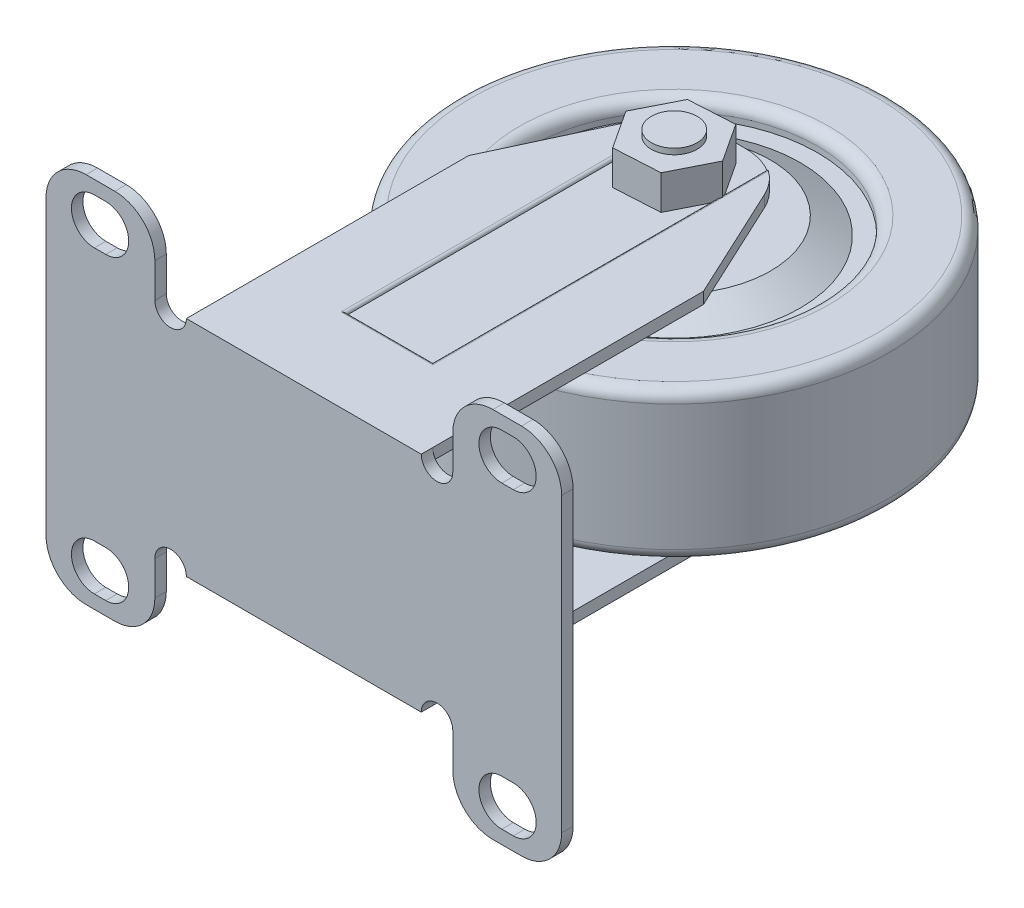
from build123d import *

# Parameters (mm, degrees)
SKETCH_1_W               = 90
SKETCH_1_H               = 65
EXTRUDE_1_DEPTH          = 2
SKETCH_2_W               = 52
SKETCH_2_H               = 13
CUT_EXTRUDE_1_DEPTH      = 56.54502678
CUT_EXTRUDE_2_DEPTH      = 56.54502678
MIRROR_3_COPY_1_DEPTH    = 56.54502678
FILLET_1_R               = 7
SKETCH_4_W               = 41
SKETCH_4_H               = 2
EXTRUDE_2_DEPTH          = 73
SKETCH_5_W               = 15
SKETCH_5_H               = 59.991373208
CUT_EXTRUDE_3_DEPTH      = 0.5
FILLET_2_R               = 0.5
FILLET_3_R               = 0.5
CHAMFER_4_SIZE           = 12
CHAMFER_4_SIZE2          = 25.734083046
CHAMFER_5_SIZE           = 12
CHAMFER_5_SIZE2          = 25.734083046
CHAMFER_6_SIZE           = 12
CHAMFER_6_SIZE2          = 25.734083046
CHAMFER_7_SIZE           = 12
CHAMFER_7_SIZE2          = 25.734083046
FILLET_4_R               = 10
EXTRUDE_3_DEPTH          = 6
EXTRUDE_START            = -41
SKETCH_7_R               = 4
EXTRUDE_4_DEPTH          = 42
SKETCH_8_R               = 2.75
CUT_EXTRUDE_4_DEPTH      = 92.707415265
MIRROR_9_COPY_1_SKETCH_R = 2.75
MIRROR_9_COPY_1_DEPTH    = 92.707415265
EXTRUDE_7_DEPTH          = 13
EXTRUDE_7_DEPTH_BACK     = 13
SKETCH_10_R              = 37.5
FILLET_5_R               = 2
SKETCH_11_R              = 25
SKETCH_11_R_2            = 22
CUT_EXTRUDE_5_DEPTH      = 3
FILLET_6_R               = 2
FILLET_7_R               = 2
CHAMFER_8_SIZE2          = 5.196152423
CHAMFER_8_SIZE           = 3
CHAMFER_9_SIZE2          = 3
CHAMFER_9_SIZE           = 5.196152423


with BuildPart() as part:
    # 草图1 → 凸台-拉伸1 (new body)
    with BuildSketch(Plane.XY):
        Rectangle(SKETCH_1_W, SKETCH_1_H)
    extrude(amount=EXTRUDE_1_DEPTH)

    # 草图2 → 切除-拉伸1 (cut, through all)
    with BuildSketch(Plane.XY.offset(2)):
        with Locations((0, 26)):
            Rectangle(SKETCH_2_W, SKETCH_2_H)
    cut_extrude_1 = extrude(amount=-CUT_EXTRUDE_1_DEPTH, mode=Mode.SUBTRACT)

    # 镜向1: 切除-拉伸1 across plane
    add(cut_extrude_1.mirror(Plane.ZX), mode=Mode.SUBTRACT)

    # 草图3 → 切除-拉伸2 (cut, through all)
    with BuildSketch(Plane.XY.offset(2)):
        with BuildLine():
            Line((-36.562223186, 30.159744382), (-34.562223186, 30.159744382))
            ThreePointArc((-34.562223186, 30.159744382), (-30.562223186, 26.159744382), (-34.562223186, 22.159744382))
            Line((-34.562223186, 22.159744382), (-36.562223186, 22.159744382))
            ThreePointArc((-36.562223186, 22.159744382), (-40.562223186, 26.159744382), (-36.562223186, 30.159744382))
        make_face()
    cut_extrude_2 = extrude(amount=-CUT_EXTRUDE_2_DEPTH, mode=Mode.SUBTRACT)

    # 镜向2: 切除-拉伸2 across plane
    add(cut_extrude_2.mirror(Plane(origin=(0, 0, 0), x_dir=(0, 0, 1), z_dir=(1, 0, 0))), mode=Mode.SUBTRACT)

    # 镜向3: 切除-拉伸2 across plane
    add(cut_extrude_2.mirror(Plane.ZX), mode=Mode.SUBTRACT)

    # 镜向3 copy 1 sketch → 镜向3 copy 1 (cut, through all)
    with BuildSketch(Plane(origin=(0, 0, 2), x_dir=(-1, 0, 0), z_dir=(0, 0, 1))):
        with BuildLine():
            Line((-36.562223186, 30.159744382), (-34.562223186, 30.159744382))
            ThreePointArc((-34.562223186, 30.159744382), (-30.562223186, 26.159744382), (-34.562223186, 22.159744382))
            Line((-34.562223186, 22.159744382), (-36.562223186, 22.159744382))
            ThreePointArc((-36.562223186, 22.159744382), (-40.562223186, 26.159744382), (-36.562223186, 30.159744382))
        make_face()
    extrude(amount=-MIRROR_3_COPY_1_DEPTH, mode=Mode.SUBTRACT)

    # 圆角1
    fillet_1_edges = [part.edges().sort_by_distance(p)[0] for p in [
        (-26, 32.5, 1),
        (26, 32.5, 1),
        (-26, -32.5, 1),
        (26, -32.5, 1),
        (45, -32.5, 1),
        (-45, -32.5, 1),
        (-45, 32.5, 1),
        (45, 32.5, 1),
    ]]
    fillet(fillet_1_edges, radius=FILLET_1_R)

    # 草图4 → 凸台-拉伸2 (add)
    with BuildSketch(Plane(origin=(0, 0, 0), x_dir=(-1, 0, 0), z_dir=(0, 0, -1))):
        with Locations((0, 18.5)):
            Rectangle(SKETCH_4_W, SKETCH_4_H)
    extrude_2 = extrude(amount=EXTRUDE_2_DEPTH)

    # 镜向4: 凸台-拉伸2 across plane
    add(extrude_2.mirror(Plane.ZX))

    # 草图5 → 切除-拉伸3 (cut)
    with BuildSketch(Plane(origin=(0, 19.5, 0), x_dir=(1, 0, 0), z_dir=(0, 1, 0))):
        with Locations((0, 43.004313396)):
            Rectangle(SKETCH_5_W, SKETCH_5_H)
    cut_extrude_3 = extrude(amount=-CUT_EXTRUDE_3_DEPTH, mode=Mode.SUBTRACT)

    # 圆角2
    fillet_2_edges = [part.edges().sort_by_distance(p)[0] for p in [
        (0, 19.5, -13.008626792),
        (7.5, 19.5, -43.004313396),
        (-7.5, 19.5, -43.004313396),
    ]]
    fillet(fillet_2_edges, radius=FILLET_2_R - 0.0001)  # a hair under: the kernel refuses the full size

    # 镜向6: 切除-拉伸3 across plane
    add(cut_extrude_3.mirror(Plane.ZX), mode=Mode.SUBTRACT)

    # 圆角3
    fillet_3_edges = [part.edges().sort_by_distance(p)[0] for p in [
        (7.5, -19.5, -43.004313396),
        (-7.5, -19.5, -43.004313396),
        (0, -19.5, -13.008626792),
    ]]
    fillet(fillet_3_edges, radius=FILLET_3_R - 0.0001)  # a hair under: the kernel refuses the full size

    # 倒角4
    chamfer_4_edges = [part.edges().sort_by_distance(p)[0] for p in [
        (-20.5, -18.5, -73),
    ]]
    chamfer_4_side = [part.faces().sort_by_distance(p)[0] for p in [
        (0, -18.423106996, -73),
    ]]
    chamfer(chamfer_4_edges, length=CHAMFER_4_SIZE, length2=CHAMFER_4_SIZE2, reference=chamfer_4_side[0])

    # 倒角5
    chamfer_5_edges = [part.edges().sort_by_distance(p)[0] for p in [
        (20.5, -18.5, -73),
    ]]
    chamfer_5_side = [part.faces().sort_by_distance(p)[0] for p in [
        (6.905756389, -18.386486006, -73),
    ]]
    chamfer(chamfer_5_edges, length=CHAMFER_5_SIZE, length2=CHAMFER_5_SIZE2, reference=chamfer_5_side[0])

    # 倒角6
    chamfer_6_edges = [part.edges().sort_by_distance(p)[0] for p in [
        (20.5, 18.5, -73),
    ]]
    chamfer_6_side = [part.faces().sort_by_distance(p)[0] for p in [
        (0, 18.423106996, -73),
    ]]
    chamfer(chamfer_6_edges, length=CHAMFER_6_SIZE, length2=CHAMFER_6_SIZE2, reference=chamfer_6_side[0])

    # 倒角7
    chamfer_7_edges = [part.edges().sort_by_distance(p)[0] for p in [
        (-20.5, 18.5, -73),
    ]]
    chamfer_7_side = [part.faces().sort_by_distance(p)[0] for p in [
        (-6.905756389, 18.386486006, -73),
    ]]
    chamfer(chamfer_7_edges, length=CHAMFER_7_SIZE, length2=CHAMFER_7_SIZE2, reference=chamfer_7_side[0])

    # 圆角4
    fillet_4_edges = [part.edges().sort_by_distance(p)[0] for p in [
        (-8.5, 18.5, -73),
        (8.5, 18.5, -73),
        (8.5, -18.5, -73),
        (-8.5, -18.5, -73),
    ]]
    fillet(fillet_4_edges, radius=FILLET_4_R)

    # 草图6 → 凸台-拉伸3 (add)
    with BuildSketch(Plane(origin=(0, 19, 0), x_dir=(1, 0, 0), z_dir=(0, 1, 0))):
        Polygon((-4.39108988, 69.342635878), (-7.986809677, 62.196252237), (-3.595719796, 55.509075728), (4.39108988, 55.96828286), (7.986809677, 63.114666501), (3.595719796, 69.801843011), align=None)
    extrude_3 = extrude(amount=EXTRUDE_3_DEPTH)

    # 草图7 → 凸台-拉伸4 (add)
    with BuildSketch(Plane(origin=(0, 25, 0), x_dir=(1, 0, 0), z_dir=(0, 1, 0)).offset(EXTRUDE_START)):
        with Locations(Location((0, 62.655459369, 0), (0, 0, 270))):
            Circle(SKETCH_7_R)
    extrude_4 = extrude(amount=EXTRUDE_4_DEPTH)

    # 镜向7: 凸台-拉伸3, 凸台-拉伸4 across plane
    add(extrude_3.mirror(Plane.ZX))
    add(extrude_4.mirror(Plane.ZX))

    # 草图8 → 切除-拉伸4 (cut, through all)
    with BuildSketch(Plane(origin=(0, 0, 0), x_dir=(-1, 0, 0), z_dir=(0, 0, -1))):
        with Locations((-23.25, 19.5)):
            Circle(SKETCH_8_R)
    cut_extrude_4 = extrude(amount=-CUT_EXTRUDE_4_DEPTH, mode=Mode.SUBTRACT)

    # 镜向8: 切除-拉伸4 across plane
    add(cut_extrude_4.mirror(Plane.ZX), mode=Mode.SUBTRACT)

    # 镜向9: 切除-拉伸4 across plane
    add(cut_extrude_4.mirror(Plane(origin=(0, 0, 0), x_dir=(0, 0, 1), z_dir=(1, 0, 0))), mode=Mode.SUBTRACT)

    # 镜向9 copy 1 sketch → 镜向9 copy 1 (cut, through all)
    with BuildSketch(Plane(origin=(0, 0, 0), x_dir=(1, 0, 0), z_dir=(0, 0, -1))):
        with Locations((-23.25, 19.5)):
            Circle(MIRROR_9_COPY_1_SKETCH_R)
    extrude(amount=-MIRROR_9_COPY_1_DEPTH, mode=Mode.SUBTRACT)

    # 草图10 → 凸台-拉伸7 (add, two sides: drawn at the far end of the back side and taken through both)
    with BuildSketch(Plane(origin=(0, 0, 0), x_dir=(1, 0, 0), z_dir=(0, 1, 0)).offset(-EXTRUDE_7_DEPTH_BACK)):
        with Locations(Location((0, 62.655459369, 0), (0, 0, 270))):
            Circle(SKETCH_10_R)
    extrude(amount=EXTRUDE_7_DEPTH + EXTRUDE_7_DEPTH_BACK)

    # 圆角5
    fillet_5_edges = [part.edges().sort_by_distance(p)[0] for p in [
        (0, -13, -100.155459369),
        (0, 13, -100.155459369),
    ]]
    fillet(fillet_5_edges, radius=FILLET_5_R)

    # 草图11 → 切除-拉伸5 (cut)
    with BuildSketch(Plane(origin=(0, 13, 0), x_dir=(1, 0, 0), z_dir=(0, 1, 0))):
        with Locations(Location((0, 62.655459369, 0), (0, 0, 270))):
            Circle(SKETCH_11_R)
        with Locations(Location((0, 62.655459369, 0), (0, 0, 270))):
            Circle(SKETCH_11_R_2, mode=Mode.SUBTRACT)
    cut_extrude_5 = extrude(amount=-CUT_EXTRUDE_5_DEPTH, mode=Mode.SUBTRACT)

    # 圆角6
    fillet_6_edges = [part.edges().sort_by_distance(p)[0] for p in [
        (0, 13, -87.655459369),
    ]]
    fillet(fillet_6_edges, radius=FILLET_6_R)

    # 镜向10: 切除-拉伸5 across plane
    add(cut_extrude_5.mirror(Plane.ZX), mode=Mode.SUBTRACT)

    # 圆角7
    fillet_7_edges = [part.edges().sort_by_distance(p)[0] for p in [
        (0, -13, -87.655459369),
    ]]
    fillet(fillet_7_edges, radius=FILLET_7_R)

    # 倒角8
    chamfer_8_edges = [part.edges().sort_by_distance(p)[0] for p in [
        (0, 13, -84.655459369),
    ]]
    chamfer_8_side = [part.faces().sort_by_distance(p)[0] for p in [
        (0, 12.94, -84.655459369),
    ]]
    chamfer(chamfer_8_edges, length=CHAMFER_8_SIZE - 0.0001, length2=CHAMFER_8_SIZE2 - 0.0001, reference=chamfer_8_side[0])  # a hair under: the kernel refuses the full size

    # 倒角9
    chamfer_9_edges = [part.edges().sort_by_distance(p)[0] for p in [
        (0, -13, -84.655459369),
    ]]
    chamfer_9_side = [part.faces().sort_by_distance(p)[0] for p in [
        (0, -13, -84.595459369),
    ]]
    chamfer(chamfer_9_edges, length=CHAMFER_9_SIZE - 0.0001, length2=CHAMFER_9_SIZE2 - 0.0001, reference=chamfer_9_side[0])  # a hair under: the kernel refuses the full size


solid = part.part
